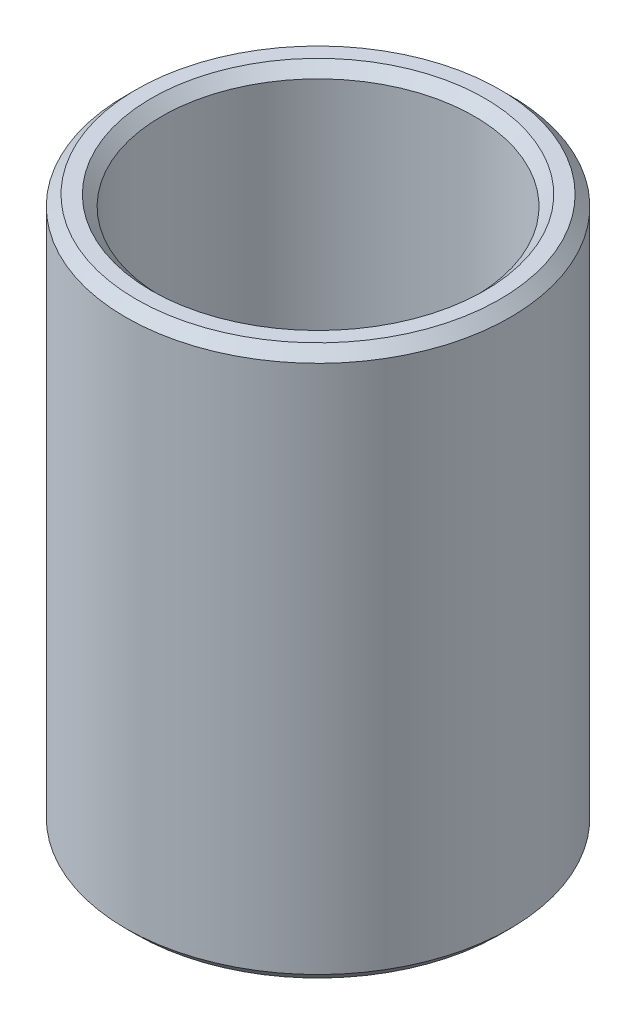
from build123d import *

# Parameters (mm, degrees)
SKETCH1_R           = 15
BOSS_EXTRUDE1_DEPTH = 42.9359155
SKETCH2_R           = 12.196056245
CUT_EXTRUDE1_DEPTH  = 48.890425346
CHAMFER1_SIZE       = 0.812536463


with BuildPart() as part:
    # Sketch1 → Boss-Extrude1 (new body)
    with BuildSketch(Plane(origin=(0, 0, 0), x_dir=(1, 0, 0), z_dir=(0, 1, 0))):
        Circle(SKETCH1_R)
    extrude(amount=BOSS_EXTRUDE1_DEPTH)

    # Sketch2 → Cut-Extrude1 (cut, through all)
    with BuildSketch(Plane(origin=(0, 0, 0), x_dir=(1, 0, 0), z_dir=(0, 1, 0))):
        Circle(SKETCH2_R)
    extrude(amount=CUT_EXTRUDE1_DEPTH, mode=Mode.SUBTRACT)

    # Chamfer1
    chamfer1_edges = [part.edges().sort_by_distance(p)[0] for p in [
        (-12.196056245, 42.9359155, 0),
        (-12.196056245, 0, 0),
        (-15, 0, 0),
        (-15, 42.9359155, 0),
    ]]
    chamfer(chamfer1_edges, length=CHAMFER1_SIZE)


solid = part.part
